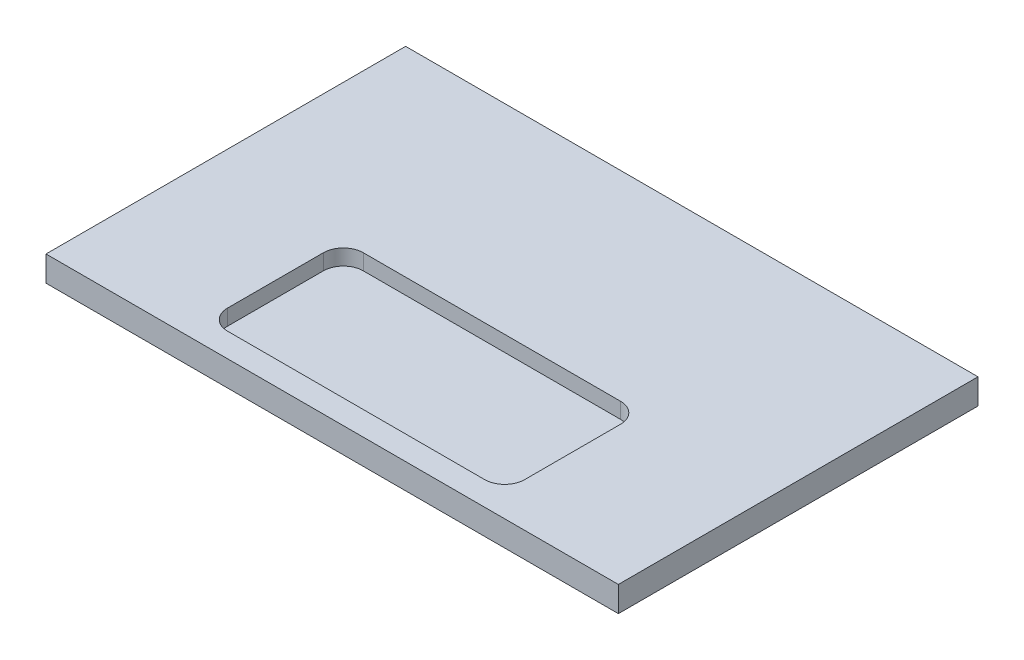
from build123d import *

# Parameters (mm, degrees)
SKETCH1_W           = 287.02
SKETCH1_H           = 180.34
BOSS_EXTRUDE3_DEPTH = 12.7
SKETCH3_W           = 149
SKETCH3_H           = 68.1
CUT_EXTRUDE1_DEPTH  = 7.874
FILLET1_R           = 10


with BuildPart() as part:
    # Sketch1 → Boss-Extrude3 (new body)
    with BuildSketch(Plane(origin=(0, 0, 0), x_dir=(1, 0, 0), z_dir=(0, 1, 0))):
        with Locations((-48.686752827, -78.346074313)):
            Rectangle(SKETCH1_W, SKETCH1_H)
    extrude(amount=BOSS_EXTRUDE3_DEPTH)

    # Sketch3 → Cut-Extrude1 (cut)
    with BuildSketch(Plane(origin=(0, 12.7, 0), x_dir=(1, 0, 0), z_dir=(0, 1, 0))):
        with Locations((-48.686752827, -122.466074313)):
            Rectangle(SKETCH3_W, SKETCH3_H)
    extrude(amount=-CUT_EXTRUDE1_DEPTH, mode=Mode.SUBTRACT)

    # Fillet1
    fillet1_edges = [part.edges().sort_by_distance(p)[0] for p in [
        (25.813247173, 8.763, 156.516074313),
        (25.813247173, 8.763, 88.416074313),
        (-123.186752827, 8.763, 156.516074313),
        (-123.186752827, 8.763, 88.416074313),
    ]]
    fillet(fillet1_edges, radius=FILLET1_R)


solid = part.part
